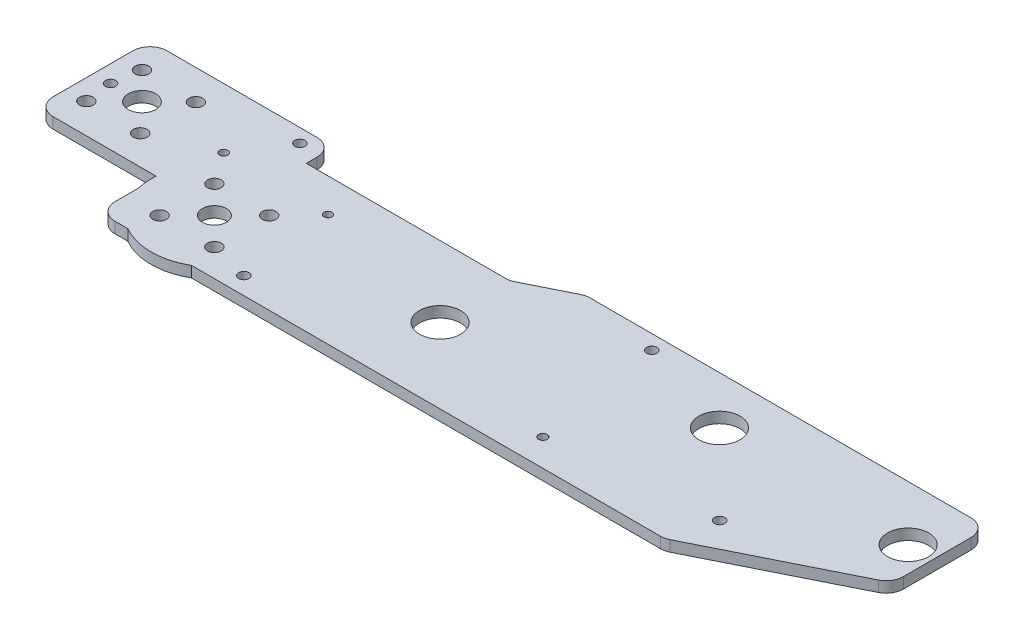
from build123d import *

# Parameters (mm, degrees)
SKETCH1_W           = 210
SKETCH1_H           = 50
SKETCH1_R           = 1.211665018
SKETCH1_R_2         = 1.165617118
SKETCH1_R_3         = 1.5
SKETCH1_R_4         = 1.25
SKETCH1_R_5         = 1.517273905
SKETCH1_R_6         = 3.4
BOSS_EXTRUDE1_DEPTH = 3.175
SKETCH2_R           = 2
CUT_EXTRUDE1_DEPTH  = 10
SKETCH3_R           = 6
SKETCH3_R_2         = 0.586995366
CUT_EXTRUDE2_DEPTH  = 57.15
CUT_EXTRUDE7_DEPTH  = 10
FILLET3_R           = 5
SKETCH11_R          = 18.5
SKETCH11_R_2        = 2
BOSS_EXTRUDE4_DEPTH = 3.175
SKETCH16_W          = 18.257640281
SKETCH16_H          = 3.175
BOSS_EXTRUDE7_DEPTH = 8.128
SKETCH17_W          = 33.3
SKETCH17_H          = 3.175
BOSS_EXTRUDE8_DEPTH = 35.56
SKETCH18_R          = 2
CUT_EXTRUDE8_DEPTH  = 9
SKETCH19_R          = 4
CUT_EXTRUDE9_DEPTH  = 40
FILLET4_R           = 5
SKETCH20_R          = 3.5
CUT_EXTRUDE10_DEPTH = 10
SKETCH21_R          = 1.5
CUT_EXTRUDE11_DEPTH = 10
SKETCH22_R          = 1.5
CUT_EXTRUDE12_DEPTH = 10
SKETCH24_R          = 1.5
CUT_EXTRUDE13_DEPTH = 10


with BuildPart() as part:
    # Sketch1 → Boss-Extrude1 (new body)
    with BuildSketch(Plane(origin=(0, 0, 0), x_dir=(1, 0, 0), z_dir=(0, 1, 0))):
        with Locations((105, -25)):
            Rectangle(SKETCH1_W, SKETCH1_H)
        with Locations((3.489526233, -16.787661112)):
            Circle(SKETCH1_R, mode=Mode.SUBTRACT)
        with Locations((34.37258772, -17.194005245)):
            Circle(SKETCH1_R_2, mode=Mode.SUBTRACT)
        with Locations((37.520749958, -44.921198121)):
            Circle(SKETCH1_R_3, mode=Mode.SUBTRACT)
        with Locations((122, -42.058139805)):
            Circle(SKETCH1_R_4, mode=Mode.SUBTRACT)
        with Locations((168.975233936, -37.403209633)):
            Circle(SKETCH1_R_5, mode=Mode.SUBTRACT)
        with Locations((18, -34)):
            Circle(SKETCH1_R_6, mode=Mode.SUBTRACT)
    extrude(amount=BOSS_EXTRUDE1_DEPTH)

    # Sketch2 → Cut-Extrude1 (cut)
    with BuildSketch(Plane(origin=(0, 3.175, 0), x_dir=(1, 0, 0), z_dir=(0, 1, 0))):
        with Locations((10, -26)):
            Circle(SKETCH2_R)
        with Locations((10, -42)):
            Circle(SKETCH2_R)
        with Locations((26, -26)):
            Circle(SKETCH2_R)
        with Locations((26, -42)):
            Circle(SKETCH2_R)
    extrude(amount=-CUT_EXTRUDE1_DEPTH, mode=Mode.SUBTRACT)

    # Sketch3 → Cut-Extrude2 (cut)
    with BuildSketch(Plane(origin=(0, 3.175, 0), x_dir=(1, 0, 0), z_dir=(0, 1, 0))):
        with Locations((78.01026379, -28.1)):
            Circle(SKETCH3_R)
        with Locations((145.531297368, -14)):
            Circle(SKETCH3_R)
        with Locations((18, -34)):
            Circle(SKETCH3_R_2)
        with Locations((202.646291021, -16)):
            Circle(SKETCH3_R)
    extrude(amount=-CUT_EXTRUDE2_DEPTH, mode=Mode.SUBTRACT)

    # Sketch10 → Cut-Extrude7 (cut)
    with BuildSketch(Plane(origin=(0, 3.175, 0), x_dir=(1, 0, 0), z_dir=(0, 1, 0))):
        Polygon((210, -27.859435908), (165.502877994, -50), (210, -50), align=None)
        Polygon((92.532613397, 0), (77.65477062, -7.402812063), (0, -7.402812063), (0, 0), align=None)
    extrude(amount=-CUT_EXTRUDE7_DEPTH, mode=Mode.SUBTRACT)

    # Fillet3
    fillet3_edges = [part.edges().sort_by_distance(p)[0] for p in [
        (77.65477062, 1.5875, 7.402812063),
        (92.532613397, 1.5875, 0),
        (210, 1.5875, 0),
        (210, 1.5875, 27.859435908),
        (165.502877994, 1.5875, 50),
    ]]
    fillet(fillet3_edges, radius=FILLET3_R)

    # Sketch11 → Boss-Extrude4 (add)
    with BuildSketch(Plane(origin=(0, 3.175, 0), x_dir=(1, 0, 0), z_dir=(0, 1, 0))):
        with Locations((18, -34)):
            Circle(SKETCH11_R)
        with Locations((10, -26)):
            Circle(SKETCH11_R_2, mode=Mode.SUBTRACT)
        with Locations((10, -42)):
            Circle(SKETCH11_R_2, mode=Mode.SUBTRACT)
        with Locations((26, -26)):
            Circle(SKETCH11_R_2, mode=Mode.SUBTRACT)
        with Locations((26, -42)):
            Circle(SKETCH11_R_2, mode=Mode.SUBTRACT)
    extrude(amount=-BOSS_EXTRUDE4_DEPTH)

    # Sketch16 → Boss-Extrude7 (add)
    with BuildSketch(Plane(origin=(0, 0, 7.402812063), x_dir=(-1, 0, 0), z_dir=(0, 0, -1))):
        with Locations((-9.128820141, 1.5875)):
            Rectangle(SKETCH16_W, SKETCH16_H)
    extrude(amount=BOSS_EXTRUDE7_DEPTH)

    # Sketch17 → Boss-Extrude8 (add)
    with BuildSketch(Plane.ZY):
        with Locations((15.924812063, 1.5875)):
            Rectangle(SKETCH17_W, SKETCH17_H)
    extrude(amount=BOSS_EXTRUDE8_DEPTH)

    # Sketch18 → Cut-Extrude8 (cut)
    with BuildSketch(Plane(origin=(0, 3.175, 0), x_dir=(1, 0, 0), z_dir=(0, 1, 0))):
        with Locations((-29.612034681, -23.798543698)):
            Circle(SKETCH18_R)
        with Locations((-29.359661767, -7.798707515)):
            Circle(SKETCH18_R)
        with Locations((-13.359825583, -8.051080428)):
            Circle(SKETCH18_R)
        with Locations((-13.612198497, -24.050916612)):
            Circle(SKETCH18_R)
    extrude(amount=-CUT_EXTRUDE8_DEPTH, mode=Mode.SUBTRACT)

    # Sketch19 → Cut-Extrude9 (cut)
    with BuildSketch(Plane(origin=(0, 3.175, 0), x_dir=(1, 0, 0), z_dir=(0, 1, 0))):
        with Locations((-21.359661767, -15.798707515)):
            Circle(SKETCH19_R)
    extrude(amount=-CUT_EXTRUDE9_DEPTH, mode=Mode.SUBTRACT)

    # Fillet4
    fillet4_edges = [part.edges().sort_by_distance(p)[0] for p in [
        (0, 1.5875, 50),
        (18.257640281, 1.5875, -0.725187937),
        (-35.56, 1.5875, -0.725187937),
        (-35.56, 1.5875, 32.574812063),
    ]]
    fillet(fillet4_edges, radius=FILLET4_R)

    # Sketch20 → Cut-Extrude10 (cut)
    with BuildSketch(Plane(origin=(0, 3.175, 0), x_dir=(1, 0, 0), z_dir=(0, 1, 0))):
        with Locations((18, -34)):
            Circle(SKETCH20_R)
    extrude(amount=-CUT_EXTRUDE10_DEPTH, mode=Mode.SUBTRACT)

    # Sketch21 → Cut-Extrude11 (cut)
    with BuildSketch(Plane(origin=(0, 3.175, 0), x_dir=(1, 0, 0), z_dir=(0, 1, 0))):
        with Locations((116, -4.237214774)):
            Circle(SKETCH21_R)
    extrude(amount=-CUT_EXTRUDE11_DEPTH, mode=Mode.SUBTRACT)

    # Sketch22 → Cut-Extrude12 (cut)
    with BuildSketch(Plane(origin=(0, 3.175, 0), x_dir=(1, 0, 0), z_dir=(0, 1, 0))):
        with Locations((12.257640281, -3.274812063)):
            Circle(SKETCH22_R)
    extrude(amount=-CUT_EXTRUDE12_DEPTH, mode=Mode.SUBTRACT)

    # Sketch24 → Cut-Extrude13 (cut)
    with BuildSketch(Plane(origin=(0, 3.175, 0), x_dir=(1, 0, 0), z_dir=(0, 1, 0))):
        with Locations((-30.56, -15.774812063)):
            Circle(SKETCH24_R)
    extrude(amount=-CUT_EXTRUDE13_DEPTH, mode=Mode.SUBTRACT)


solid = part.part
